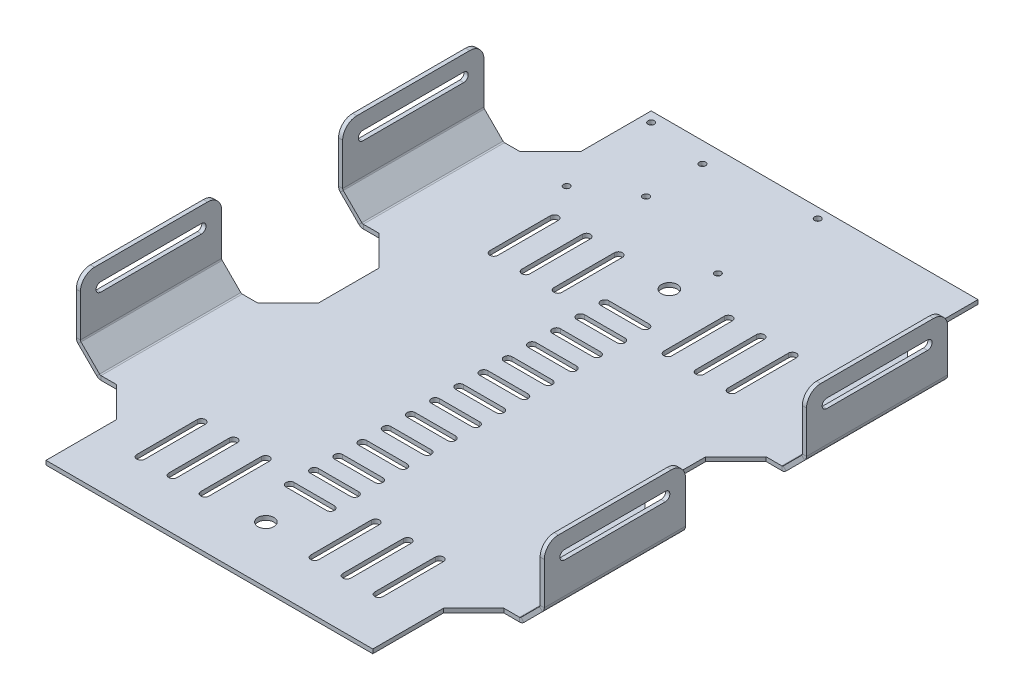
from build123d import *

# Parameters (mm, degrees)
BASE_FLANGE1_START       = -150
BASE_FLANGE1_DEPTH       = 300
CUT_EXTRUDE1_START       = -40
CUT_EXTRUDE1_OUTLINE_W   = 35
CUT_EXTRUDE1_OUTLINE_H   = 60
CUT_EXTRUDE1_OUTLINE_H_2 = 50
CUT_EXTRUDE1_DEPTH       = 40
CHAMFER1_SIZE            = 15
CUT_EXTRUDE2_DEPTH       = 280.14870589
FILLET1_R                = 7
CUT_EXTRUDE3_DEPTH       = 2.06
SKETCH10_R               = 1.5875
CUT_EXTRUDE4_DEPTH       = 2.06
CUT_EXTRUDE5_DEPTH       = 2.06
SKETCH15_R               = 3.96875
CUT_EXTRUDE6_DEPTH       = 2.06


# Read off the part's stored shape, not the designer's step: Base-Flange1, Cut-Extrude1
with BuildPart() as part:
    # Base-Flange1 outline → Base-Flange1 (new body)
    with BuildSketch(Plane.XY.offset(BASE_FLANGE1_START)):
        with BuildLine():
            Line((116, 12.267493501), (116, 40))
            Line((116, 40), (113.94, 40))
            Line((113.94, 40), (113.94, 12.267493501))
            ThreePointArc((113.94, 12.267493501), (113.863879533, 11.884810068), (113.647106781, 11.56038672))
            Line((113.647106781, 11.56038672), (104.43961328, 2.352893219))
            ThreePointArc((104.43961328, 2.352893219), (104.115189932, 2.136120467), (103.732506499, 2.06))
            Line((103.732506499, 2.06), (-103.732506499, 2.06))
            ThreePointArc((-103.732506499, 2.06), (-104.115189932, 2.136120467), (-104.43961328, 2.352893219))
            Line((-104.43961328, 2.352893219), (-113.647106781, 11.56038672))
            ThreePointArc((-113.647106781, 11.56038672), (-113.863879533, 11.884810068), (-113.94, 12.267493501))
            Line((-113.94, 12.267493501), (-113.94, 40))
            Line((-113.94, 40), (-116, 40))
            Line((-116, 40), (-116, 12.267493501))
            ThreePointArc((-116, 12.267493501), (-115.767071369, 11.096482198), (-115.10374675, 10.10374675))
            Line((-115.10374675, 10.10374675), (-105.89625325, 0.89625325))
            ThreePointArc((-105.89625325, 0.89625325), (-104.903517802, 0.232928631), (-103.732506499, 0))
            Line((-103.732506499, 0), (103.732506499, 0))
            ThreePointArc((103.732506499, 0), (104.903517802, 0.232928631), (105.89625325, 0.89625325))
            Line((105.89625325, 0.89625325), (115.10374675, 10.10374675))
            ThreePointArc((115.10374675, 10.10374675), (115.767071369, 11.096482198), (116, 12.267493501))
        make_face()
    extrude(amount=BASE_FLANGE1_DEPTH)

    # Cut-Extrude1 outline → Cut-Extrude1 (cut)
    with BuildSketch(Plane(origin=(0, 0, 0), x_dir=(-1, 0, 0), z_dir=(0, -1, 0)).offset(CUT_EXTRUDE1_START)):
        with Locations((98.5, 0)):
            Rectangle(CUT_EXTRUDE1_OUTLINE_W, CUT_EXTRUDE1_OUTLINE_H)
        with Locations((98.5, -125)):
            Rectangle(CUT_EXTRUDE1_OUTLINE_W, CUT_EXTRUDE1_OUTLINE_H_2)
        with Locations((98.5, 125)):
            Rectangle(CUT_EXTRUDE1_OUTLINE_W, CUT_EXTRUDE1_OUTLINE_H_2)
        with Locations((-98.5, -125)):
            Rectangle(CUT_EXTRUDE1_OUTLINE_W, CUT_EXTRUDE1_OUTLINE_H_2)
        with Locations((-98.5, 125)):
            Rectangle(CUT_EXTRUDE1_OUTLINE_W, CUT_EXTRUDE1_OUTLINE_H_2)
        with Locations((-98.5, 0)):
            Rectangle(CUT_EXTRUDE1_OUTLINE_W, CUT_EXTRUDE1_OUTLINE_H)
    extrude(amount=CUT_EXTRUDE1_DEPTH, mode=Mode.SUBTRACT)

    # Chamfer1
    chamfer1_edges = [part.edges().sort_by_distance(p)[0] for p in [
        (-81, 1.03, 100),
        (81, 1.03, -100),
        (81, 1.03, -30),
        (81, 1.03, 30),
        (-81, 1.03, -100),
        (81, 1.03, 100),
        (-81, 1.03, 30),
        (-81, 1.03, -30),
    ]]
    chamfer(chamfer1_edges, length=CHAMFER1_SIZE)

    # Sketch7 → Cut-Extrude2 (cut, through all)
    with BuildSketch(Plane(origin=(116, 0, 0), x_dir=(0, 0, -1), z_dir=(1, 0, 0))):
        with BuildLine():
            Line((90, 27.75), (40, 27.75))
            ThreePointArc((40, 27.75), (37.75, 30), (40, 32.25))
            Line((40, 32.25), (90, 32.25))
            ThreePointArc((90, 32.25), (92.25, 30), (90, 27.75))
        make_face()
        with BuildLine():
            Line((-90, 27.75), (-40, 27.75))
            ThreePointArc((-40, 27.75), (-37.75, 30), (-40, 32.25))
            Line((-40, 32.25), (-90, 32.25))
            ThreePointArc((-90, 32.25), (-92.25, 30), (-90, 27.75))
        make_face()
    extrude(amount=-CUT_EXTRUDE2_DEPTH, mode=Mode.SUBTRACT)

    # Fillet1
    fillet1_edges = [part.edges().sort_by_distance(p)[0] for p in [
        (-114.97, 40, 100),
        (114.97, 40, -100),
        (114.97, 40, 30),
        (114.97, 40, -30),
        (-114.97, 40, -100),
        (114.97, 40, 100),
        (-114.97, 40, 30),
        (-114.97, 40, -30),
    ]]
    fillet(fillet1_edges, radius=FILLET1_R)

    # Sketch8 → Cut-Extrude3 (cut)
    with BuildSketch(Plane(origin=(0, 2.06, 0), x_dir=(1, 0, 0), z_dir=(0, 1, 0))):
        with BuildLine():
            Line((57, -125), (57, -95))
            ThreePointArc((57, -95), (59, -93), (61, -95))
            Line((61, -95), (61, -125))
            ThreePointArc((61, -125), (59, -127), (57, -125))
        make_face()
        with BuildLine():
            Line((25.25, -125), (25.25, -95))
            ThreePointArc((25.25, -95), (27.25, -93), (29.25, -95))
            Line((29.25, -95), (29.25, -125))
            ThreePointArc((29.25, -125), (27.25, -127), (25.25, -125))
        make_face()
        with BuildLine():
            Line((61, 80), (61, 50))
            ThreePointArc((61, 50), (59, 48), (57, 50))
            Line((57, 50), (57, 80))
            ThreePointArc((57, 80), (59, 82), (61, 80))
        make_face()
        with BuildLine():
            Line((29.25, 80), (29.25, 50))
            ThreePointArc((29.25, 50), (27.25, 48), (25.25, 50))
            Line((25.25, 50), (25.25, 80))
            ThreePointArc((25.25, 80), (27.25, 82), (29.25, 80))
        make_face()
        with BuildLine():
            Line((-57, -125), (-57, -95))
            ThreePointArc((-57, -95), (-59, -93), (-61, -95))
            Line((-61, -95), (-61, -125))
            ThreePointArc((-61, -125), (-59, -127), (-57, -125))
        make_face()
        with BuildLine():
            Line((-25.25, -125), (-25.25, -95))
            ThreePointArc((-25.25, -95), (-27.25, -93), (-29.25, -95))
            Line((-29.25, -95), (-29.25, -125))
            ThreePointArc((-29.25, -125), (-27.25, -127), (-25.25, -125))
        make_face()
        with BuildLine():
            Line((-61, 80), (-61, 50))
            ThreePointArc((-61, 50), (-59, 48), (-57, 50))
            Line((-57, 50), (-57, 80))
            ThreePointArc((-57, 80), (-59, 82), (-61, 80))
        make_face()
        with BuildLine():
            Line((-29.25, 80), (-29.25, 50))
            ThreePointArc((-29.25, 50), (-27.25, 48), (-25.25, 50))
            Line((-25.25, 50), (-25.25, 80))
            ThreePointArc((-25.25, 80), (-27.25, 82), (-29.25, 80))
        make_face()
        with BuildLine():
            Line((45.125, 80), (45.125, 50))
            ThreePointArc((45.125, 50), (43.125, 48), (41.125, 50))
            Line((41.125, 50), (41.125, 80))
            ThreePointArc((41.125, 80), (43.125, 82), (45.125, 80))
        make_face()
        with BuildLine():
            Line((45.125, -95), (45.125, -125))
            ThreePointArc((45.125, -125), (43.125, -127), (41.125, -125))
            Line((41.125, -125), (41.125, -95))
            ThreePointArc((41.125, -95), (43.125, -93), (45.125, -95))
        make_face()
        with BuildLine():
            Line((-45.125, 80), (-45.125, 50))
            ThreePointArc((-45.125, 50), (-43.125, 48), (-41.125, 50))
            Line((-41.125, 50), (-41.125, 80))
            ThreePointArc((-41.125, 80), (-43.125, 82), (-45.125, 80))
        make_face()
        with BuildLine():
            Line((-45.125, -95), (-45.125, -125))
            ThreePointArc((-45.125, -125), (-43.125, -127), (-41.125, -125))
            Line((-41.125, -125), (-41.125, -95))
            ThreePointArc((-41.125, -95), (-43.125, -93), (-45.125, -95))
        make_face()
    extrude(amount=-CUT_EXTRUDE3_DEPTH, mode=Mode.SUBTRACT)

    # Sketch10 → Cut-Extrude4 (cut)
    with BuildSketch(Plane(origin=(0, 2.06, 0), x_dir=(1, 0, 0), z_dir=(0, 1, 0))):
        with Locations(Location((5.28, 96.74, 0), (0, 0, 180))):
            Circle(SKETCH10_R)
        with Locations(Location((6.55, 145, 0), (0, 0, 180))):
            Circle(SKETCH10_R)
        with Locations(Location((-76, 145, 0), (0, 0, 180))):
            Circle(SKETCH10_R)
        with Locations(Location((-69.65, 96.74, 0), (0, 0, 180))):
            Circle(SKETCH10_R)
        with Locations(Location((-45.52, 111.98, 0), (0, 0, 180))):
            Circle(SKETCH10_R)
        with Locations(Location((-45.52, 139.92, 0), (0, 0, 180))):
            Circle(SKETCH10_R)
    extrude(amount=-CUT_EXTRUDE4_DEPTH, mode=Mode.SUBTRACT)

    # Sketch14 → Cut-Extrude5 (cut)
    with BuildSketch(Plane(origin=(0, 2.06, 0), x_dir=(1, 0, 0), z_dir=(0, 1, 0))):
        with BuildLine():
            Line((10, 54), (-10, 54))
            ThreePointArc((-10, 54), (-12, 56), (-10, 58))
            Line((-10, 58), (10, 58))
            ThreePointArc((10, 58), (12, 56), (10, 54))
        make_face()
        with BuildLine():
            Line((10, 42), (-10, 42))
            ThreePointArc((-10, 42), (-12, 44), (-10, 46))
            Line((-10, 46), (10, 46))
            ThreePointArc((10, 46), (12, 44), (10, 42))
        make_face()
        with BuildLine():
            Line((10, 30), (-10, 30))
            ThreePointArc((-10, 30), (-12, 32), (-10, 34))
            Line((-10, 34), (10, 34))
            ThreePointArc((10, 34), (12, 32), (10, 30))
        make_face()
        with BuildLine():
            Line((10, 18), (-10, 18))
            ThreePointArc((-10, 18), (-12, 20), (-10, 22))
            Line((-10, 22), (10, 22))
            ThreePointArc((10, 22), (12, 20), (10, 18))
        make_face()
        with BuildLine():
            Line((10, 6), (-10, 6))
            ThreePointArc((-10, 6), (-12, 8), (-10, 10))
            Line((-10, 10), (10, 10))
            ThreePointArc((10, 10), (12, 8), (10, 6))
        make_face()
        with BuildLine():
            Line((10, -6), (-10, -6))
            ThreePointArc((-10, -6), (-12, -4), (-10, -2))
            Line((-10, -2), (10, -2))
            ThreePointArc((10, -2), (12, -4), (10, -6))
        make_face()
        with BuildLine():
            Line((10, -18), (-10, -18))
            ThreePointArc((-10, -18), (-12, -16), (-10, -14))
            Line((-10, -14), (10, -14))
            ThreePointArc((10, -14), (12, -16), (10, -18))
        make_face()
        with BuildLine():
            Line((10, -30), (-10, -30))
            ThreePointArc((-10, -30), (-12, -28), (-10, -26))
            Line((-10, -26), (10, -26))
            ThreePointArc((10, -26), (12, -28), (10, -30))
        make_face()
        with BuildLine():
            Line((10, -42), (-10, -42))
            ThreePointArc((-10, -42), (-12, -40), (-10, -38))
            Line((-10, -38), (10, -38))
            ThreePointArc((10, -38), (12, -40), (10, -42))
        make_face()
        with BuildLine():
            Line((10, -54), (-10, -54))
            ThreePointArc((-10, -54), (-12, -52), (-10, -50))
            Line((-10, -50), (10, -50))
            ThreePointArc((10, -50), (12, -52), (10, -54))
        make_face()
        with BuildLine():
            Line((10, -66), (-10, -66))
            ThreePointArc((-10, -66), (-12, -64), (-10, -62))
            Line((-10, -62), (10, -62))
            ThreePointArc((10, -62), (12, -64), (10, -66))
        make_face()
        with BuildLine():
            Line((10, -78), (-10, -78))
            ThreePointArc((-10, -78), (-12, -76), (-10, -74))
            Line((-10, -74), (10, -74))
            ThreePointArc((10, -74), (12, -76), (10, -78))
        make_face()
        with BuildLine():
            Line((10, -90), (-10, -90))
            ThreePointArc((-10, -90), (-12, -88), (-10, -86))
            Line((-10, -86), (10, -86))
            ThreePointArc((10, -86), (12, -88), (10, -90))
        make_face()
        with BuildLine():
            Line((10, -102), (-10, -102))
            ThreePointArc((-10, -102), (-12, -100), (-10, -98))
            Line((-10, -98), (10, -98))
            ThreePointArc((10, -98), (12, -100), (10, -102))
        make_face()
    extrude(amount=-CUT_EXTRUDE5_DEPTH, mode=Mode.SUBTRACT)

    # Sketch15 → Cut-Extrude6 (cut)
    with BuildSketch(Plane(origin=(0, 2.06, 0), x_dir=(1, 0, 0), z_dir=(0, 1, 0))):
        with Locations(Location((0, -122, 0), (0, 0, 180))):
            Circle(SKETCH15_R)
        with Locations(Location((0, 78, 0), (0, 0, 180))):
            Circle(SKETCH15_R)
    extrude(amount=-CUT_EXTRUDE6_DEPTH, mode=Mode.SUBTRACT)


solid = part.part
